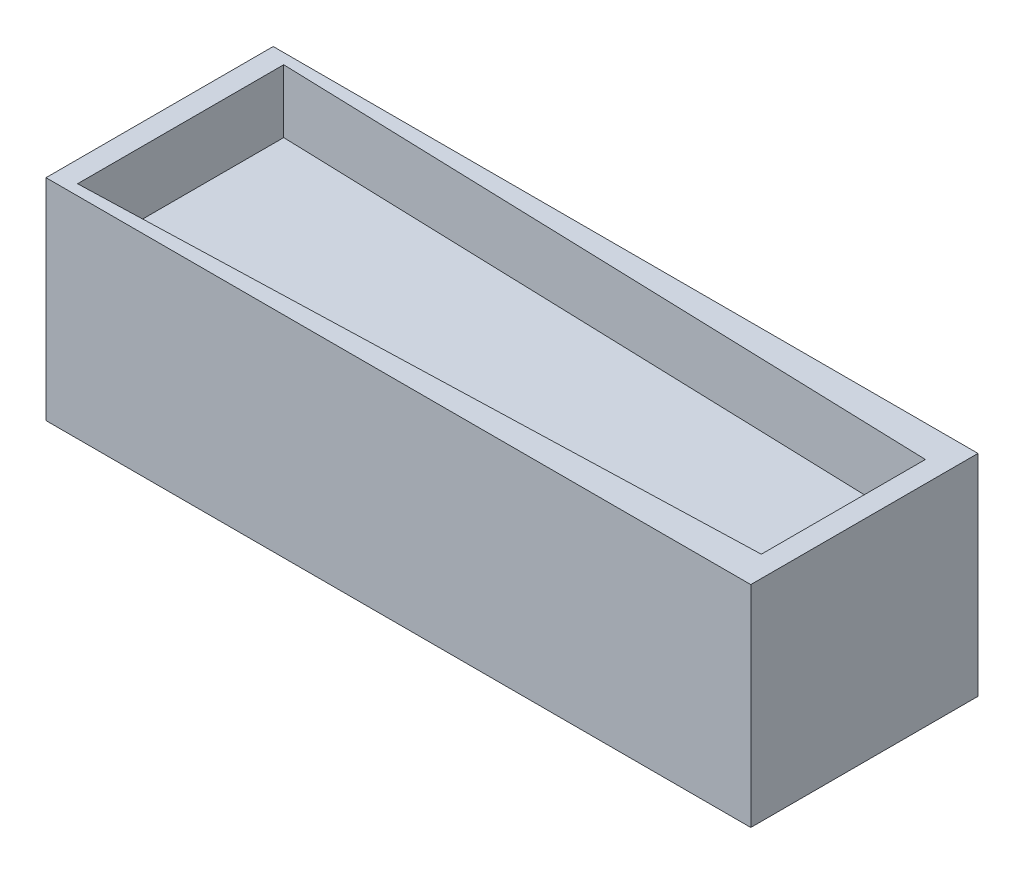
from build123d import *

# Parameters (mm, degrees)
SKETCH2_W           = 335
SKETCH2_H           = 108
BOSS_EXTRUDE4_DEPTH = 100
CUT_EXTRUDE1_DEPTH  = 30
SKETCH4_W           = 300
SKETCH4_H           = 100
CUT_EXTRUDE2_DEPTH  = 68


with BuildPart() as part:
    # Sketch2 → Boss-Extrude4 (new body)
    with BuildSketch(Plane(origin=(0, 0, 0), x_dir=(1, 0, 0), z_dir=(0, 1, 0))):
        Rectangle(SKETCH2_W, SKETCH2_H)
    extrude(amount=-BOSS_EXTRUDE4_DEPTH)

    # Sketch3 → Cut-Extrude1 (cut)
    with BuildSketch(Plane(origin=(0, 0, 0), x_dir=(1, 0, 0), z_dir=(0, 1, 0))):
        Polygon((-157.5, -49), (-157.5, 49), (157.5, 39), (157.5, -39), align=None)
    extrude(amount=-CUT_EXTRUDE1_DEPTH, mode=Mode.SUBTRACT)

    # Sketch4 → Cut-Extrude2 (cut)
    with BuildSketch(Plane(origin=(0, -100, 0), x_dir=(-1, 0, 0), z_dir=(0, -1, 0))):
        Rectangle(SKETCH4_W, SKETCH4_H)
    extrude(amount=-CUT_EXTRUDE2_DEPTH, mode=Mode.SUBTRACT)


solid = part.part
